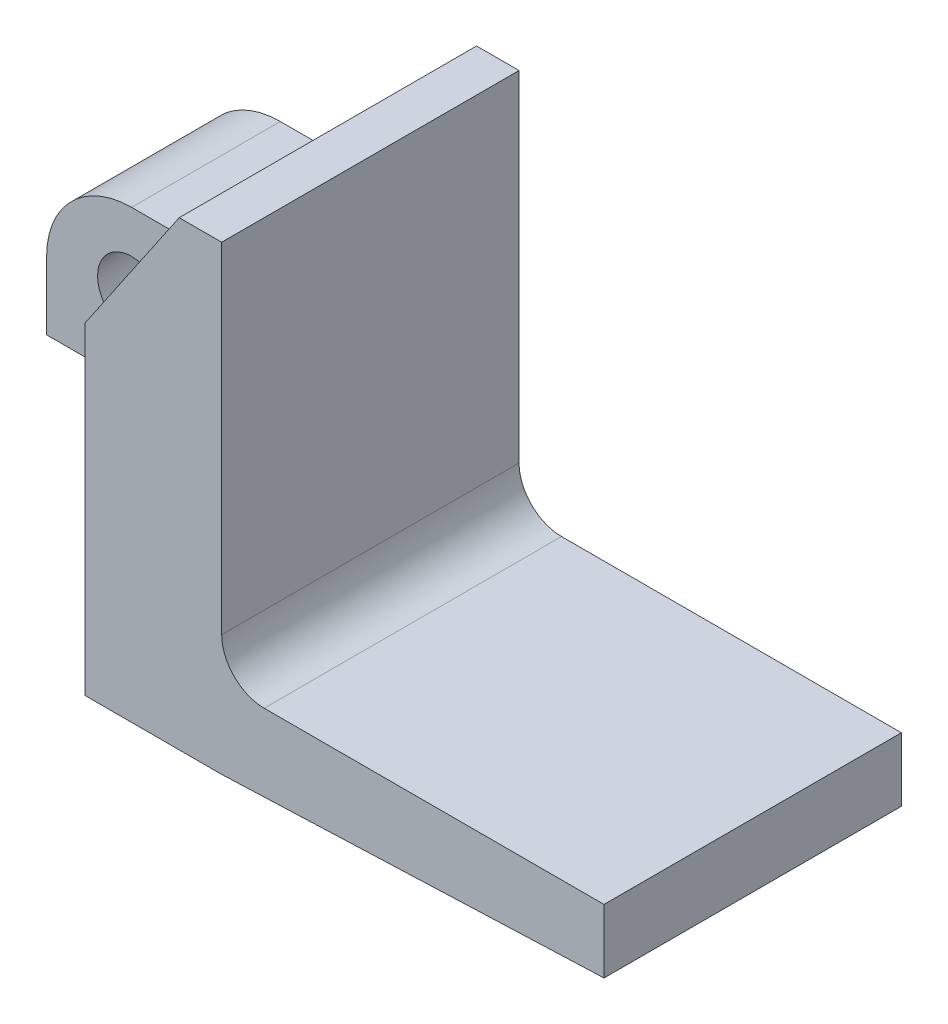
from build123d import *

# Parameters (mm, degrees)
BOSS_EXTRUDE1_DEPTH                                  = 44.45
FILLET2_R                                            = 6.35
CUT_EXTRUDE1_START                                   = -22.225
CUT_EXTRUDE1_DEPTH                                   = 22.225
FILLET3_R                                            = 2.54
CBORE_FOR_3_8_BINDING_HEAD_MACHINE_SCREW_D           = 10.16
CBORE_FOR_3_8_BINDING_HEAD_MACHINE_SCREW_CBORE_D     = 20.828
CBORE_FOR_3_8_BINDING_HEAD_MACHINE_SCREW_CBORE_DEPTH = 6.4262


with BuildPart() as part:
    # Sketch1 → Boss-Extrude1 (new body)
    with BuildSketch(Plane.XY):
        with BuildLine():
            Line((0, 0), (57.15, 0))
            Line((57.15, 0), (57.15, -9.525))
            Line((57.15, -9.525), (0, -11.7445024))
            Line((0, -11.7445024), (-20.4502, -11.7445024))
            Line((-20.4502, -11.7445024), (-20.4502, 9.8454976))
            Line((-20.4502, 9.8454976), (-48.3902, 9.8454976))
            Line((-48.3902, 9.8454976), (-48.3902, 20.0054976))
            ThreePointArc((-48.3902, 20.0054976), (-44.670456121, 28.985753721), (-35.6902, 32.7054976))
            Line((-35.6902, 32.7054976), (-22.9902, 32.7054976))
            Line((-22.9902, 32.7054976), (-6.35, 57.15))
            Line((-6.35, 57.15), (0, 57.15))
            Line((0, 57.15), (0, 0))
        make_face()
    extrude(amount=BOSS_EXTRUDE1_DEPTH)

    # Fillet2
    fillet2_edges = [part.edges().sort_by_distance(p)[0] for p in [
        (0, 0, 22.225),
    ]]
    fillet(fillet2_edges, radius=FILLET2_R)

    # Sketch3 → Cut-Extrude1 (cut)
    with BuildSketch(Plane.XY.offset(44.45).offset(CUT_EXTRUDE1_START)):
        with BuildLine():
            Line((-48.3902, 9.8454976), (-20.4502, 9.8454976))
            Line((-20.4502, 9.8454976), (-20.4502, 36.436765018))
            Line((-20.4502, 36.436765018), (-22.9902, 32.7054976))
            Line((-22.9902, 32.7054976), (-35.6902, 32.7054976))
            ThreePointArc((-35.6902, 32.7054976), (-44.670456121, 28.985753721), (-48.3902, 20.0054976))
            Line((-48.3902, 20.0054976), (-48.3902, 9.8454976))
        make_face()
    extrude(amount=CUT_EXTRUDE1_DEPTH, mode=Mode.SUBTRACT)

    # Fillet3
    fillet3_edges = [part.edges().sort_by_distance(p)[0] for p in [
        (-22.9902, 32.7054976, 11.1125),
    ]]
    fillet(fillet3_edges, radius=FILLET3_R)

    # CBORE for 3/8 Binding Head Machine Screw1 (through all)
    with Locations(Plane(origin=(0, 0, 0), x_dir=(-1, 0, 0), z_dir=(0, 0, -1))):
        with Locations((35.6902, 21.2754976)):
            CounterBoreHole(CBORE_FOR_3_8_BINDING_HEAD_MACHINE_SCREW_D / 2, CBORE_FOR_3_8_BINDING_HEAD_MACHINE_SCREW_CBORE_D / 2, CBORE_FOR_3_8_BINDING_HEAD_MACHINE_SCREW_CBORE_DEPTH)


solid = part.part
